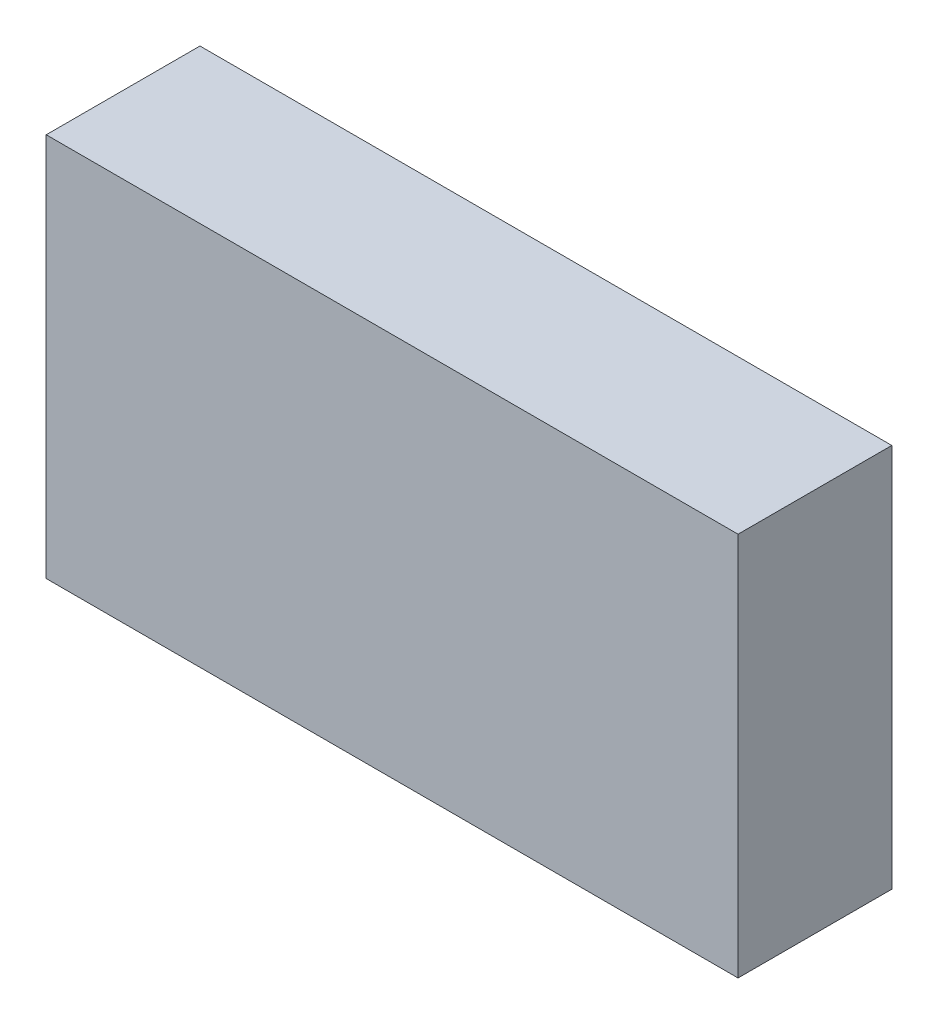
from build123d import *

# Parameters (mm, degrees)
IZIM1_W            = 90
IZIM1_H            = 50
TABAN_FLAN_1_DEPTH = 20


# Sheet-metal steps are written as plain solids
with BuildPart() as part:
    # Çizim1 → Taban-Flanş1 (new body)
    with BuildSketch(Plane.XY):
        with Locations((45, -25)):
            Rectangle(IZIM1_W, IZIM1_H)
    extrude(amount=-TABAN_FLAN_1_DEPTH)


solid = part.part
